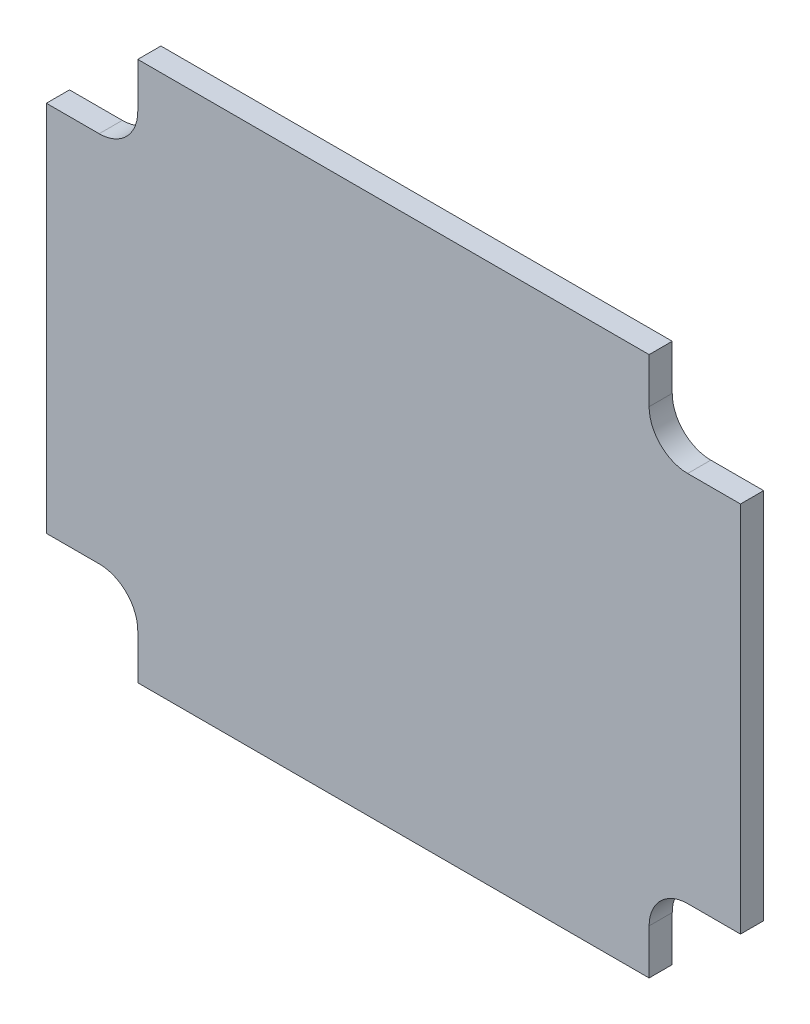
from build123d import *

# Parameters (mm, degrees)
EXTRUDE_1_DEPTH = 3
FILLET_1_R      = 5


with BuildPart() as part:
    # 草图3 → 凸台-拉伸1 (new body)
    with BuildSketch(Plane.XY):
        Polygon((44.926262989, 23.313727624), (33.076262989, 23.313727624), (33.076262989, 34.163727624), (-33.223737011, 34.163727624), (-33.223737011, 23.313727624), (-45.073737011, 23.313727624), (-45.073737011, -24.986272376), (-33.223737011, -24.986272376), (-33.223737011, -35.836272376), (33.076262989, -35.836272376), (33.076262989, -24.986272376), (44.926262989, -24.986272376), align=None)
    extrude(amount=EXTRUDE_1_DEPTH)

    # 圆角1
    fillet_1_edges = [part.edges().sort_by_distance(p)[0] for p in [
        (-33.223737011, -24.986272376, 1.5),
        (33.076262989, -24.986272376, 1.5),
        (33.076262989, 23.313727624, 1.5),
        (-33.223737011, 23.313727624, 1.5),
    ]]
    fillet(fillet_1_edges, radius=FILLET_1_R)


solid = part.part
